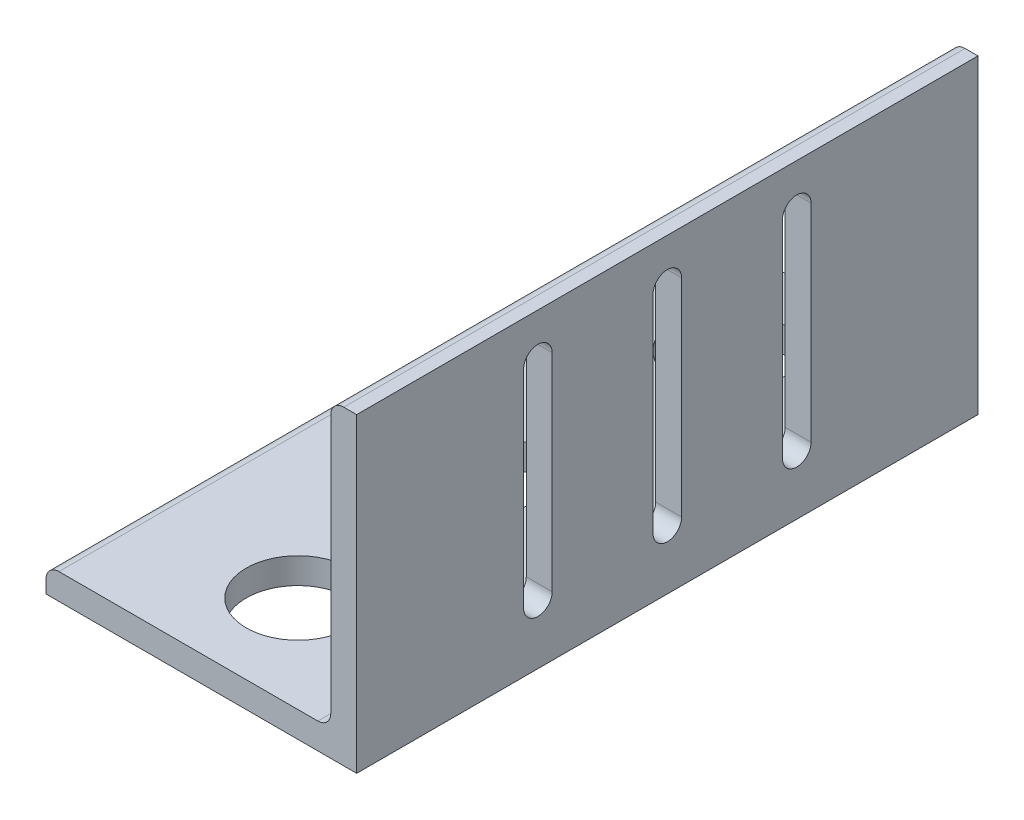
from build123d import *

# Parameters (mm, degrees)
BOSS_EXTRUDE1_DEPTH = 76.2
CUT_EXTRUDE1_DEPTH  = 10
SKETCH4_R           = 10
SKETCH4_R_2         = 12.7
CUT_EXTRUDE2_DEPTH  = 10


with BuildPart() as part:
    # Sketch2 → Boss-Extrude1 (new, symmetric)
    with BuildSketch(Plane.XY):
        with BuildLine():
            Line((-38.1, 0), (38.1, 0))
            Line((38.1, 0), (38.1, 76.2))
            Line((38.1, 76.2), (34.925, 76.2))
            ThreePointArc((34.925, 76.2), (32.67993597, 75.27006403), (31.75, 73.025))
            Line((31.75, 73.025), (31.75, 9.525))
            ThreePointArc((31.75, 9.525), (30.82006403, 7.27993597), (28.575, 6.35))
            Line((28.575, 6.35), (-34.925, 6.35))
            ThreePointArc((-34.925, 6.35), (-37.17006403, 5.42006403), (-38.1, 3.175))
            Line((-38.1, 3.175), (-38.1, 0))
        make_face()
    extrude(amount=BOSS_EXTRUDE1_DEPTH, both=True)

    # Sketch3 → Cut-Extrude1 (cut)
    with BuildSketch(Plane(origin=(38.1, 0, 0), x_dir=(0, 0, -1), z_dir=(1, 0, 0))):
        with BuildLine():
            Line((-28.25, 65.4), (-28.25, 14.6))
            ThreePointArc((-28.25, 14.6), (-31.75, 11.1), (-35.25, 14.6))
            Line((-35.25, 14.6), (-35.25, 65.4))
            ThreePointArc((-35.25, 65.4), (-31.75, 68.9), (-28.25, 65.4))
        make_face()
        with BuildLine():
            Line((28.25, 65.4), (28.25, 14.6))
            ThreePointArc((28.25, 14.6), (31.75, 11.1), (35.25, 14.6))
            Line((35.25, 14.6), (35.25, 65.4))
            ThreePointArc((35.25, 65.4), (31.75, 68.9), (28.25, 65.4))
        make_face()
        with BuildLine():
            Line((3.5, 65.4), (3.5, 14.6))
            ThreePointArc((3.5, 14.6), (0, 11.1), (-3.5, 14.6))
            Line((-3.5, 14.6), (-3.5, 65.4))
            ThreePointArc((-3.5, 65.4), (0, 68.9), (3.5, 65.4))
        make_face()
    extrude(amount=-CUT_EXTRUDE1_DEPTH, mode=Mode.SUBTRACT)

    # Sketch4 → Cut-Extrude2 (cut)
    with BuildSketch(Plane.XZ):
        Circle(SKETCH4_R)
        with Locations((0, 52.5)):
            Circle(SKETCH4_R_2)
        with Locations((0, -52.5)):
            Circle(SKETCH4_R_2)
    extrude(amount=-CUT_EXTRUDE2_DEPTH, mode=Mode.SUBTRACT)


solid = part.part
